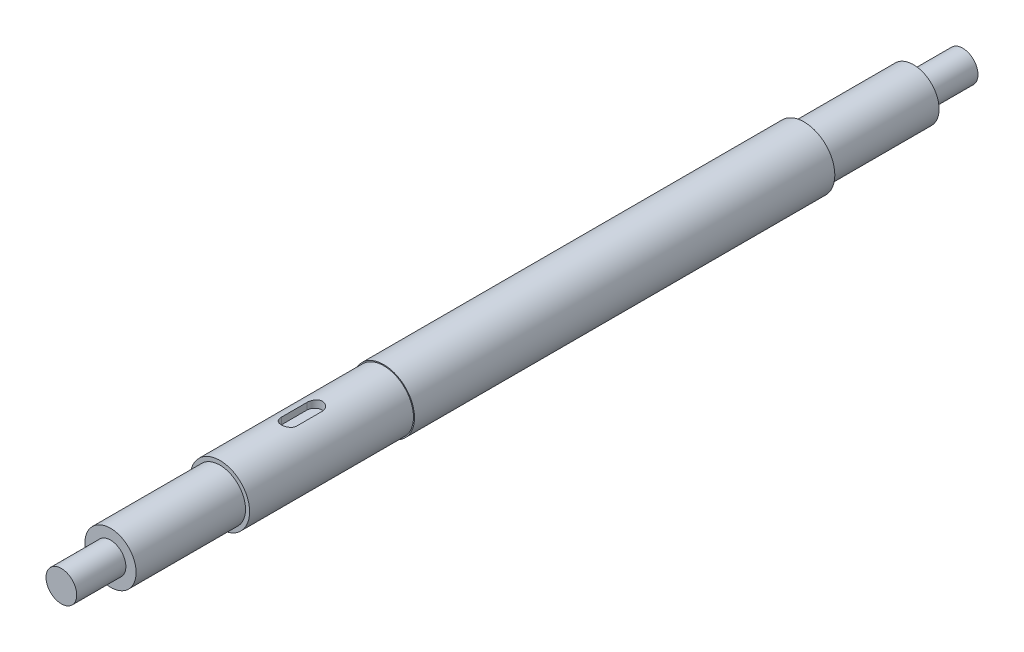
from build123d import *

# Parameters (mm, degrees)
SKETCH1_R           = 9.525
BOSS_EXTRUDE1_DEPTH = 139.7
CUT_EXTRUDE1_REACH  = 232.645
SKETCH3_R           = 9.525
SKETCH3_R_2         = 7.9375
CUT_EXTRUDE2_REACH  = 266.503
SKETCH4_R           = 7.9375
SKETCH4_R_2         = 4.7625
SKETCH5_R           = 9.525
SKETCH5_R_2         = 9.2075
CUT_EXTRUDE3_DEPTH  = 50.8
CUT_EXTRUDE4_DEPTH  = 2.38125


with BuildPart() as part:
    # Sketch1 → Boss-Extrude1 (new, symmetric)
    with BuildSketch(Plane.XY):
        Circle(SKETCH1_R)
    extrude(amount=BOSS_EXTRUDE1_DEPTH, both=True)

    # Sketch3 → Cut-Extrude1 (cut, up to next)
    with BuildSketch(Plane.XY.offset(90.551), mode=Mode.PRIVATE) as cut_extrude1_sk1:
        Circle(SKETCH3_R)
        Circle(SKETCH3_R_2, mode=Mode.SUBTRACT)
    cut_extrude1_tool1 = extrude(cut_extrude1_sk1.sketch, amount=CUT_EXTRUDE1_REACH, mode=Mode.PRIVATE) & part.part
    cut_extrude1 = cut_extrude1_tool1.solids().sort_by_distance((-9.255592, 0, 90.551))[0]
    add(cut_extrude1, mode=Mode.SUBTRACT)

    # Mirror1: Cut-Extrude1 across plane
    add(cut_extrude1.mirror(Plane.XY), mode=Mode.SUBTRACT)

    # Sketch4 → Cut-Extrude2 (cut, up to next)
    with BuildSketch(Plane.XY.offset(124.46), mode=Mode.PRIVATE) as cut_extrude2_sk1:
        Circle(SKETCH4_R)
        Circle(SKETCH4_R_2, mode=Mode.SUBTRACT)
    cut_extrude2_tool1 = extrude(cut_extrude2_sk1.sketch, amount=CUT_EXTRUDE2_REACH, mode=Mode.PRIVATE) & part.part
    cut_extrude2 = cut_extrude2_tool1.solids().sort_by_distance((-7.712994, 0, 124.46))[0]
    add(cut_extrude2, mode=Mode.SUBTRACT)

    # Mirror2: Cut-Extrude2 across plane
    add(cut_extrude2.mirror(Plane.XY), mode=Mode.SUBTRACT)

    # Sketch5 → Cut-Extrude3 (cut)
    with BuildSketch(Plane.XY.offset(90.551)):
        Circle(SKETCH5_R)
        Circle(SKETCH5_R_2, mode=Mode.SUBTRACT)
    extrude(amount=-CUT_EXTRUDE3_DEPTH, mode=Mode.SUBTRACT)

    # Sketch6 → Cut-Extrude4 (cut)
    with BuildSketch(Plane(origin=(0, 9.2075, 0), x_dir=(1, 0, 0), z_dir=(0, 1, 0))):
        with BuildLine():
            Line((-2.38125, -61.18225), (-2.38125, -69.11975))
            ThreePointArc((-2.38125, -69.11975), (0, -71.501), (2.38125, -69.11975))
            Line((2.38125, -69.11975), (2.38125, -61.18225))
            ThreePointArc((2.38125, -61.18225), (0, -58.801), (-2.38125, -61.18225))
        make_face()
    extrude(amount=-CUT_EXTRUDE4_DEPTH, mode=Mode.SUBTRACT)


solid = part.part
